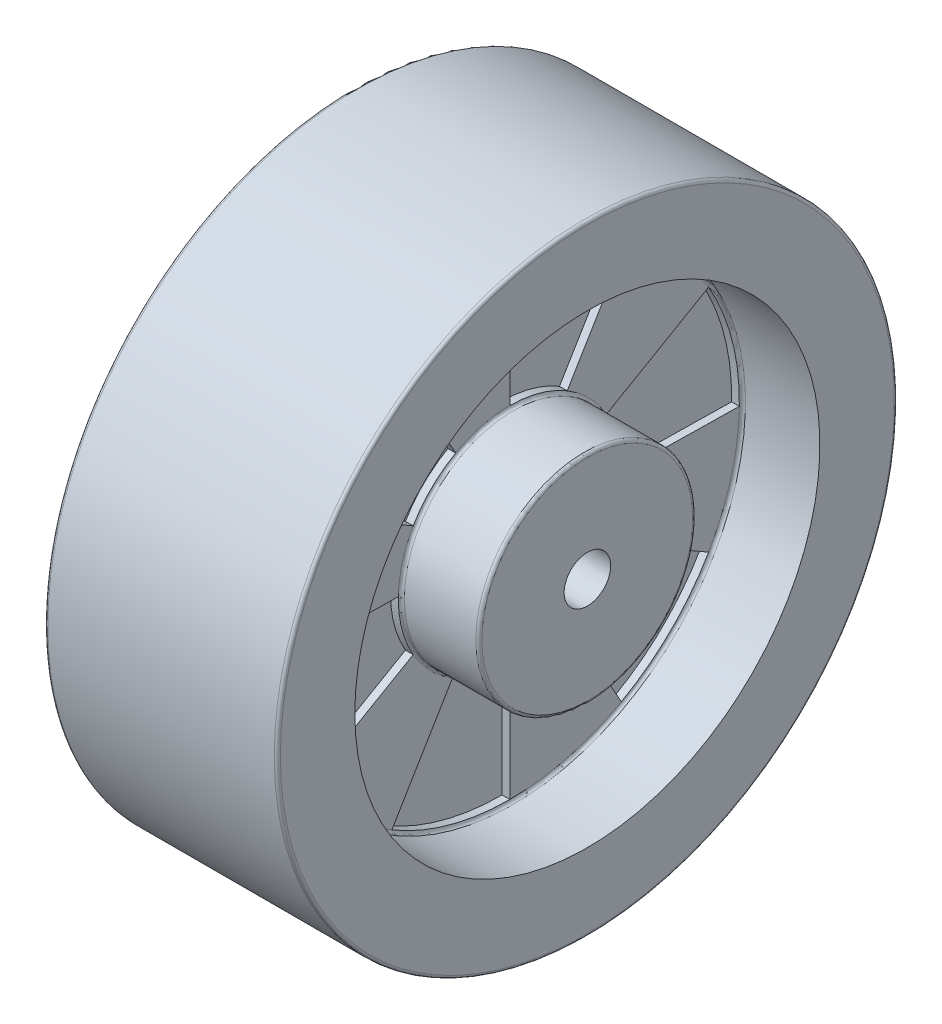
from build123d import *

# Parameters (mm, degrees)
FILLET1_R            = 1
CUT_EXTRUDE1_DEPTH   = 2.54
CIRPATTERN1_COUNT    = 6
MIRROR1_COPY_1_DEPTH = 2.54
MIRROR1_COPY_2_DEPTH = 2.54
MIRROR1_COPY_3_DEPTH = 2.54
MIRROR1_COPY_4_DEPTH = 2.54
MIRROR1_COPY_5_DEPTH = 2.54
MIRROR1_COPY_6_DEPTH = 2.54


with BuildPart() as part:
    # Sketch1 → Revolve1 (revolve)
    with BuildSketch(Plane.XY):
        Polygon((-38.1, 7.62), (38.1, 7.62), (38.1, 35.56), (12.7, 35.56), (12.7, 76.2), (38.1, 76.2), (38.1, 101.6), (-38.1, 101.6), (-38.1, 76.2), (-12.7, 76.2), (-12.7, 35.56), (-38.1, 35.56), align=None)
    revolve(axis=Axis((0, 0, 0), (1, 0, 0)))

    # Fillet1
    fillet1_edges = [part.edges().sort_by_distance(p)[0] for p in [
        (12.7, -76.2, 0),
        (12.7, -35.56, 0),
        (38.1, -35.56, 0),
        (-12.7, -35.56, 0),
        (-38.1, -35.56, 0),
        (-12.7, -76.2, 0),
        (38.1, -101.6, 0),
        (-38.1, -101.6, 0),
    ]]
    fillet(fillet1_edges, radius=FILLET1_R)

    # Sketch2 → Cut-Extrude1 (cut)
    with BuildSketch(Plane(origin=(12.7, 0, 0), x_dir=(0, 0, -1), z_dir=(1, 0, 0))):
        with BuildLine():
            Line((0, 75.2), (0, 36.56))
            ThreePointArc((0, 36.56), (9.754400868, 35.234716739), (18.801616606, 31.35494878))
            Line((18.801616606, 31.35494878), (38.67290943, 64.493767732))
            ThreePointArc((38.67290943, 64.493767732), (20.063756709, 72.474034431), (0, 75.2))
        make_face()
    cut_extrude1 = extrude(amount=-CUT_EXTRUDE1_DEPTH, mode=Mode.SUBTRACT)

    # CirPattern1: Cut-Extrude1 ×6 about axis
    cirpattern1_axis = Axis((38.1, 0, 0), (1, 0, 0))
    for i in range(1, CIRPATTERN1_COUNT):
        add(cut_extrude1.rotate(cirpattern1_axis, i * 360 / CIRPATTERN1_COUNT), mode=Mode.SUBTRACT)

    # Mirror1 copy 1 sketch → Mirror1 copy 1 (cut)
    with BuildSketch(Plane(origin=(-12.7, 0, 0), x_dir=(0, 0.8660254037844386, -0.5000000000000001), z_dir=(-1, 0, 0))):
        with BuildLine():
            Line((0, -75.2), (0, -36.56))
            ThreePointArc((0, -36.56), (9.754400868, -35.234716739), (18.801616606, -31.35494878))
            Line((18.801616606, -31.35494878), (38.67290943, -64.493767732))
            ThreePointArc((38.67290943, -64.493767732), (20.063756709, -72.474034431), (0, -75.2))
        make_face()
    extrude(amount=-MIRROR1_COPY_1_DEPTH, mode=Mode.SUBTRACT)

    # Mirror1 copy 2 sketch → Mirror1 copy 2 (cut)
    with BuildSketch(Plane(origin=(-12.7, 0, 0), x_dir=(0, 0.8660254037844387, 0.4999999999999998), z_dir=(-1, 0, 0))):
        with BuildLine():
            Line((0, -75.2), (0, -36.56))
            ThreePointArc((0, -36.56), (9.754400868, -35.234716739), (18.801616606, -31.35494878))
            Line((18.801616606, -31.35494878), (38.67290943, -64.493767732))
            ThreePointArc((38.67290943, -64.493767732), (20.063756709, -72.474034431), (0, -75.2))
        make_face()
    extrude(amount=-MIRROR1_COPY_2_DEPTH, mode=Mode.SUBTRACT)

    # Mirror1 copy 3 sketch → Mirror1 copy 3 (cut)
    with BuildSketch(Plane.ZY.offset(12.7)):
        with BuildLine():
            Line((0, -75.2), (0, -36.56))
            ThreePointArc((0, -36.56), (9.754400868, -35.234716739), (18.801616606, -31.35494878))
            Line((18.801616606, -31.35494878), (38.67290943, -64.493767732))
            ThreePointArc((38.67290943, -64.493767732), (20.063756709, -72.474034431), (0, -75.2))
        make_face()
    extrude(amount=-MIRROR1_COPY_3_DEPTH, mode=Mode.SUBTRACT)

    # Mirror1 copy 4 sketch → Mirror1 copy 4 (cut)
    with BuildSketch(Plane(origin=(-12.7, 0, 0), x_dir=(0, -0.8660254037844384, 0.5000000000000004), z_dir=(-1, 0, 0))):
        with BuildLine():
            Line((0, -75.2), (0, -36.56))
            ThreePointArc((0, -36.56), (9.754400868, -35.234716739), (18.801616606, -31.35494878))
            Line((18.801616606, -31.35494878), (38.67290943, -64.493767732))
            ThreePointArc((38.67290943, -64.493767732), (20.063756709, -72.474034431), (0, -75.2))
        make_face()
    extrude(amount=-MIRROR1_COPY_4_DEPTH, mode=Mode.SUBTRACT)

    # Mirror1 copy 5 sketch → Mirror1 copy 5 (cut)
    with BuildSketch(Plane(origin=(-12.7, 0, 0), x_dir=(0, -0.8660254037844386, -0.5000000000000001), z_dir=(-1, 0, 0))):
        with BuildLine():
            Line((0, -75.2), (0, -36.56))
            ThreePointArc((0, -36.56), (9.754400868, -35.234716739), (18.801616606, -31.35494878))
            Line((18.801616606, -31.35494878), (38.67290943, -64.493767732))
            ThreePointArc((38.67290943, -64.493767732), (20.063756709, -72.474034431), (0, -75.2))
        make_face()
    extrude(amount=-MIRROR1_COPY_5_DEPTH, mode=Mode.SUBTRACT)

    # Mirror1 copy 6 sketch → Mirror1 copy 6 (cut)
    with BuildSketch(Plane(origin=(-12.7, 0, 0), x_dir=(0, 0, -1), z_dir=(-1, 0, 0))):
        with BuildLine():
            Line((0, -75.2), (0, -36.56))
            ThreePointArc((0, -36.56), (9.754400868, -35.234716739), (18.801616606, -31.35494878))
            Line((18.801616606, -31.35494878), (38.67290943, -64.493767732))
            ThreePointArc((38.67290943, -64.493767732), (20.063756709, -72.474034431), (0, -75.2))
        make_face()
    extrude(amount=-MIRROR1_COPY_6_DEPTH, mode=Mode.SUBTRACT)


solid = part.part
